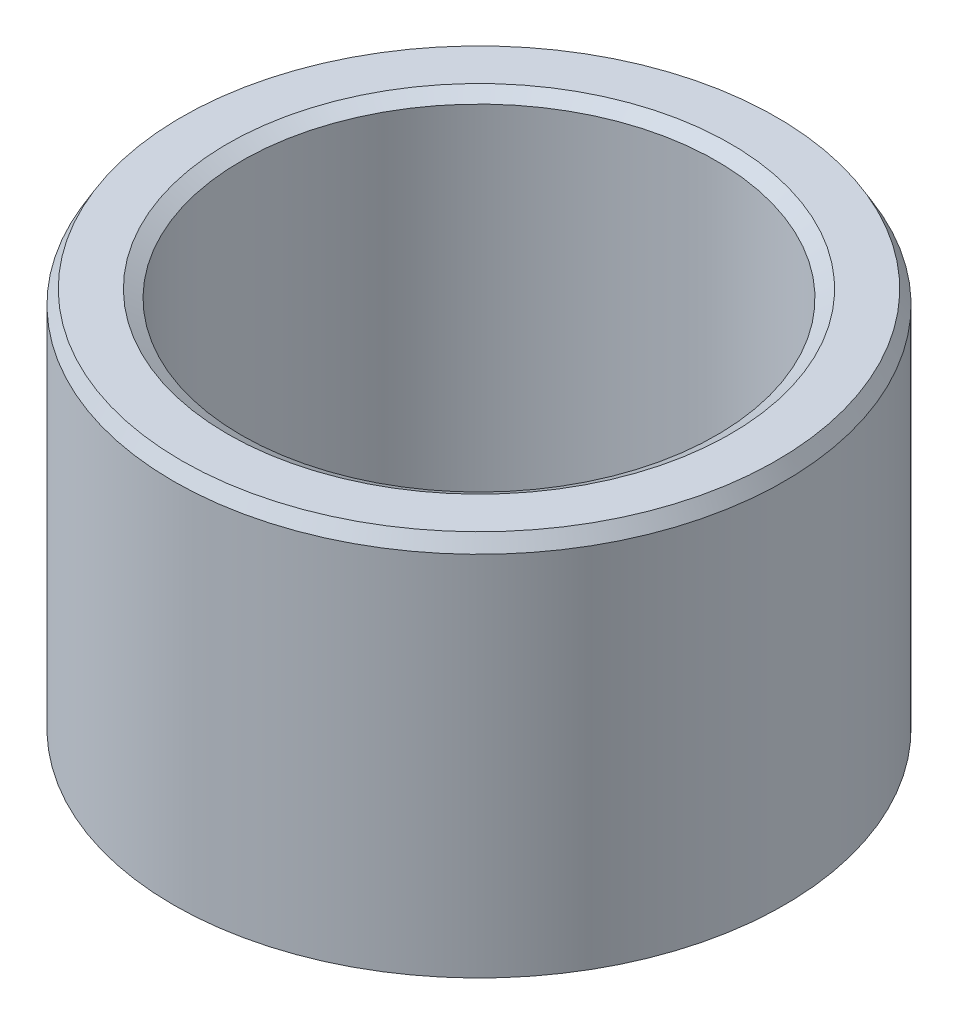
from build123d import *
from OCP.BRepFilletAPI import BRepFilletAPI_MakeChamfer

# Parameters (mm, degrees)
SKETCH1_R           = 25
BOSS_EXTRUDE1_DEPTH = 31.81604246
SKETCH2_R           = 19.440811721
CUT_EXTRUDE1_DEPTH  = 48.563226949
CHAMFER1_SIZE       = 1.135533223
CHAMFER1_SIZE2      = 0.655600412


with BuildPart() as part:
    # Sketch1 → Boss-Extrude1 (new body)
    with BuildSketch(Plane(origin=(0, 0, 0), x_dir=(1, 0, 0), z_dir=(0, 1, 0))):
        Circle(SKETCH1_R)
    extrude(amount=BOSS_EXTRUDE1_DEPTH)

    # Sketch2 → Cut-Extrude1 (cut, through all)
    with BuildSketch(Plane(origin=(0, 0, 0), x_dir=(1, 0, 0), z_dir=(0, 1, 0))):
        Circle(SKETCH2_R)
    extrude(amount=CUT_EXTRUDE1_DEPTH, mode=Mode.SUBTRACT)

    # Chamfer1: one chamfer whose edges measure the first distance from different faces: ONE call of the kernel's chamfer builder (chamfer() names one face for all edges)
    chamfer1_edges_1 = [part.edges().sort_by_distance(p)[0] for p in [
        (-19.440811721, 31.81604246, 0),
    ]]
    chamfer1_side_1 = [part.faces().sort_by_distance(p)[0] for p in [
        (-24.292893219, 31.81604246, 0),
    ]]
    chamfer1_edges_2 = [part.edges().sort_by_distance(p)[0] for p in [
        (-19.440811721, 0, 0),
    ]]
    chamfer1_side_2 = [part.faces().sort_by_distance(p)[0] for p in [
        (-19.440811721, 15.90802123, 0),
    ]]
    chamfer1_edges_3 = [part.edges().sort_by_distance(p)[0] for p in [
        (-25, 0, 0),
    ]]
    chamfer1_side_3 = [part.faces().sort_by_distance(p)[0] for p in [
        (-24.292893219, 0, 0),
    ]]
    chamfer1_edges_4 = [part.edges().sort_by_distance(p)[0] for p in [
        (-25, 31.81604246, 0),
    ]]
    chamfer1_side_4 = [part.faces().sort_by_distance(p)[0] for p in [
        (-25, 15.90802123, 0),
    ]]
    chamfer1 = BRepFilletAPI_MakeChamfer(part.part.solid().wrapped)
    for e in chamfer1_edges_1:
        chamfer1.Add(CHAMFER1_SIZE, CHAMFER1_SIZE2, e.wrapped, chamfer1_side_1[0].wrapped)  # the first distance lies on this face
    for e in chamfer1_edges_2:
        chamfer1.Add(CHAMFER1_SIZE, CHAMFER1_SIZE2, e.wrapped, chamfer1_side_2[0].wrapped)  # the first distance lies on this face
    for e in chamfer1_edges_3:
        chamfer1.Add(CHAMFER1_SIZE, CHAMFER1_SIZE2, e.wrapped, chamfer1_side_3[0].wrapped)  # the first distance lies on this face
    for e in chamfer1_edges_4:
        chamfer1.Add(CHAMFER1_SIZE, CHAMFER1_SIZE2, e.wrapped, chamfer1_side_4[0].wrapped)  # the first distance lies on this face
    add(Compound.cast(chamfer1.Shape()), mode=Mode.REPLACE)


solid = part.part
